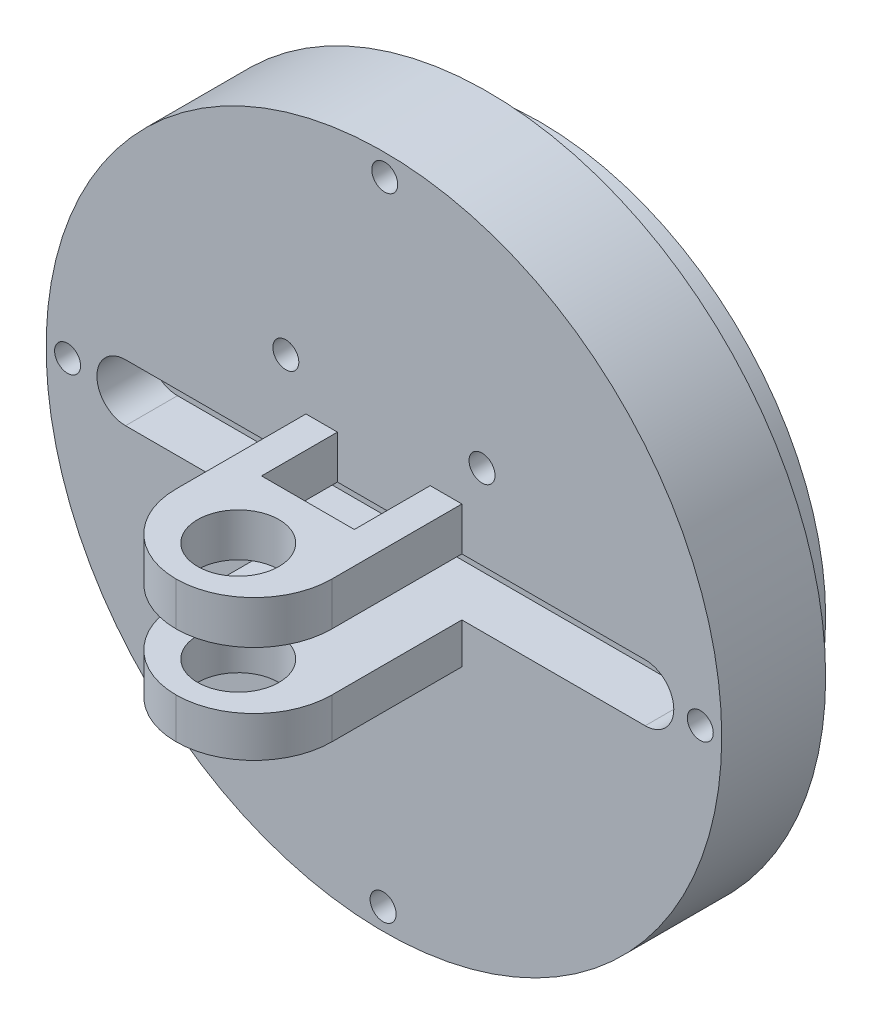
from build123d import *

# Parameters (mm, degrees)
SKETCH2_R           = 65
BOSS_EXTRUDE1_DEPTH = 20
SKETCH4_R           = 55
BOSS_EXTRUDE2_DEPTH = 10
SHELL1_T            = -20
CUT_EXTRUDE4_DEPTH  = 10
CIRPATTERN3_COUNT   = 12
CUT_EXTRUDE5_DEPTH  = 10
SKETCH13_R          = 2.5
CUT_EXTRUDE7_DEPTH  = 10
CIRPATTERN4_COUNT   = 4
SKETCH14_W          = 30
SKETCH14_H          = 8.321649063
SKETCH14_H_2        = 7.815978975
BOSS_EXTRUDE3_DEPTH = 40
SKETCH15_R          = 7.825
CUT_EXTRUDE8_DEPTH  = 60
FILLET3_R           = 15
SKETCH16_W          = 17.850622268
SKETCH16_H          = 14.602901006
CUT_EXTRUDE9_DEPTH  = 10
SKETCH19_R          = 2.5
CUT_EXTRUDE10_DEPTH = 10


with BuildPart() as part:
    # Sketch2 → Boss-Extrude1 (new body)
    with BuildSketch(Plane(origin=(0, 0, 0), x_dir=(0, 1, 0), z_dir=(0, 0, 1))):
        with Locations(Location((0, 0, 0), (0, 0, 270))):
            Circle(SKETCH2_R)
    extrude(amount=BOSS_EXTRUDE1_DEPTH)

    # Sketch4 → Boss-Extrude2 (add)
    with BuildSketch(Plane(origin=(0, 0, 0), x_dir=(1, 0, 0), z_dir=(0, 0, -1))):
        with Locations(Location((0, 0, 0), (0, 0, 180))):
            Circle(SKETCH4_R)
    extrude(amount=BOSS_EXTRUDE2_DEPTH)

    # Shell1
    shell1_openings = [part.faces().sort_by_distance(p)[0] for p in [
        (0, 0, -10),
    ]]
    offset(amount=SHELL1_T, openings=shell1_openings, kind=Kind.INTERSECTION)

    # Sketch11 → Cut-Extrude4 (cut)
    with BuildSketch(Plane(origin=(0, 0, -10), x_dir=(1, 0, 0), z_dir=(0, 0, -1))):
        Polygon((-0.14294056, 45.151393391), (2.152952162, 45.151393391), (6.37913534, 34.41375644), (-6.666711392, 34.359204869), (-2.847047838, 45.151393391), align=None)
    cut_extrude4 = extrude(amount=-CUT_EXTRUDE4_DEPTH, mode=Mode.SUBTRACT)

    # CirPattern3: Cut-Extrude4 ×12 about axis
    cirpattern3_axis = Axis((0, 0, 0), (0, 0, 1))
    for i in range(1, CIRPATTERN3_COUNT):
        add(cut_extrude4.rotate(cirpattern3_axis, i * 360 / CIRPATTERN3_COUNT), mode=Mode.SUBTRACT)

    # Sketch12 → Cut-Extrude5 (cut)
    with BuildSketch(Plane.XY.offset(20)):
        with BuildLine():
            Line((-49.724225287, 5.5), (50.275774713, 5.5))
            ThreePointArc((50.275774713, 5.5), (55.775774713, 0), (50.275774713, -5.5))
            Line((50.275774713, -5.5), (-49.724225287, -5.5))
            ThreePointArc((-49.724225287, -5.5), (-55.224225287, 0), (-49.724225287, 5.5))
        make_face()
    extrude(amount=-CUT_EXTRUDE5_DEPTH, mode=Mode.SUBTRACT)

    # Sketch13 → Cut-Extrude7 (cut)
    with BuildSketch(Plane.XY.offset(20)):
        with Locations((0.158711009, 60.870900594)):
            Circle(SKETCH13_R)
    cut_extrude7 = extrude(amount=-CUT_EXTRUDE7_DEPTH, mode=Mode.SUBTRACT)

    # CirPattern4: Cut-Extrude7 ×4 about axis
    cirpattern4_axis = Axis((0, 0, 0), (0, 0, 1))
    for i in range(1, CIRPATTERN4_COUNT):
        add(cut_extrude7.rotate(cirpattern4_axis, i * 360 / CIRPATTERN4_COUNT), mode=Mode.SUBTRACT)

    # Sketch14 → Boss-Extrude3 (add)
    with BuildSketch(Plane.XY.offset(20)):
        with Locations((0, 9.660824532)):
            Rectangle(SKETCH14_W, SKETCH14_H)
        with Locations((0, -9.407989488)):
            Rectangle(SKETCH14_W, SKETCH14_H_2)
    extrude(amount=BOSS_EXTRUDE3_DEPTH)

    # Sketch15 → Cut-Extrude8 (cut)
    with BuildSketch(Plane.XZ.offset(13.315978975)):
        with Locations(Location((0, 48.024835591, 0), (0, 0, 270))):
            Circle(SKETCH15_R)
    extrude(amount=-CUT_EXTRUDE8_DEPTH, mode=Mode.SUBTRACT)

    # Fillet3
    fillet3_edges = [part.edges().sort_by_distance(p)[0] for p in [
        (-15, -9.407989488, 60),
        (-15, 9.660824531, 60),
        (15, 9.660824531, 60),
        (15, -9.407989488, 60),
    ]]
    fillet(fillet3_edges, radius=FILLET3_R - 0.0001)  # a hair under: the kernel refuses the full size

    # Sketch16 → Cut-Extrude9 (cut)
    with BuildSketch(Plane(origin=(0, 13.821649063, 0), x_dir=(-1, 0, 0), z_dir=(0, 1, 0))):
        with Locations((0.019760197, 27.301450503)):
            Rectangle(SKETCH16_W, SKETCH16_H)
    extrude(amount=-CUT_EXTRUDE9_DEPTH, mode=Mode.SUBTRACT)

    # Sketch19 → Cut-Extrude10 (cut)
    with BuildSketch(Plane.XY.offset(20)):
        with Locations((-18.87834994, 21.74381377)):
            Circle(SKETCH19_R)
        with Locations((18.87834994, 21.74381377)):
            Circle(SKETCH19_R)
    extrude(amount=-CUT_EXTRUDE10_DEPTH, mode=Mode.SUBTRACT)


solid = part.part
